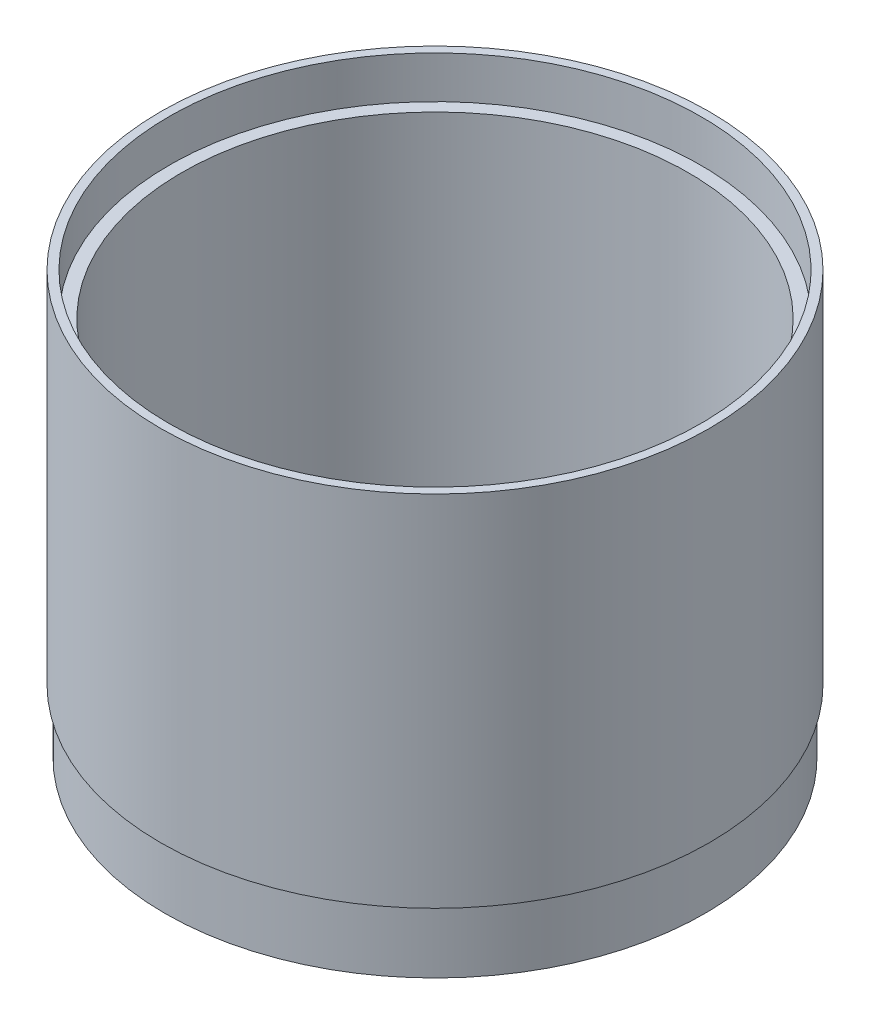
from build123d import *


with BuildPart() as part:
    # Szkic1 → Obrót1 (revolve)
    with BuildSketch(Plane.XY):
        Polygon((-64, 15), (-64, 0), (-60, 0), (-60, 90), (-63, 90), (-63, 100), (-65, 100), (-65, 28.561789866), (-65, 15), align=None)
    revolve(axis=Axis((0, 35.541039942, 0), (0, -1, 0)))


solid = part.part
